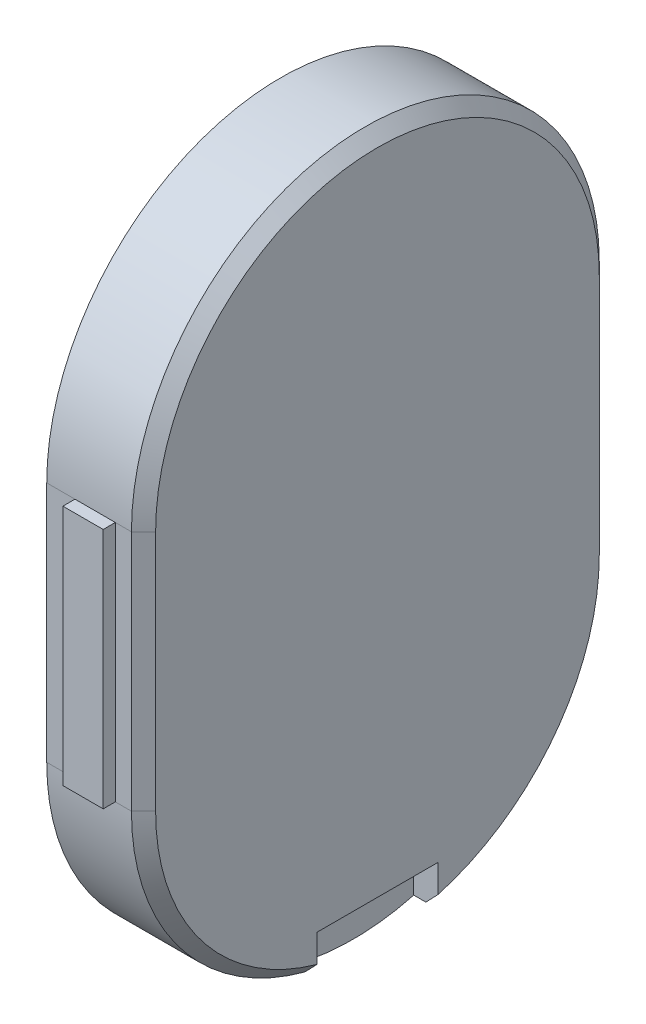
from build123d import *

# Parameters (mm, degrees)
BOSS_EXTRUDE1_START = 35.6
BOSS_EXTRUDE1_DEPTH = 2.4
CHAMFER1_SIZE       = 0.3
BOSS_EXTRUDE2_START = 82.2
SKETCH2_W           = 1
SKETCH2_H           = 6
BOSS_EXTRUDE2_DEPTH = 0.31
BOSS_EXTRUDE3_START = 94.09
SKETCH3_W           = 1
SKETCH3_H           = 6
BOSS_EXTRUDE3_DEPTH = 0.31
BOSS_EXTRUDE4_START = 86.8
SKETCH4_W           = 0.7
SKETCH4_H           = 1.3
BOSS_EXTRUDE4_DEPTH = 3


with BuildPart() as part:
    # Sketch1 → Boss-Extrude1 (new body)
    with BuildSketch(Plane(origin=(0, 0, 0), x_dir=(0, 0, -1), z_dir=(1, 0, 0)).offset(BOSS_EXTRUDE1_START)):
        with BuildLine():
            Line((-94.1, 53), (-94.1, 59))
            ThreePointArc((-94.1, 59), (-92.401219331, 63.101219331), (-88.3, 64.8))
            ThreePointArc((-88.3, 64.8), (-84.198780669, 63.101219331), (-82.5, 59))
            Line((-82.5, 59), (-82.5, 53))
            ThreePointArc((-82.5, 53), (-84.198780669, 48.898780669), (-88.3, 47.2))
            ThreePointArc((-88.3, 47.2), (-92.401219331, 48.898780669), (-94.1, 53))
        make_face()
    extrude(amount=BOSS_EXTRUDE1_DEPTH)

    # Chamfer1
    chamfer1_edges = [part.edges().sort_by_distance(p)[0] for p in [
        (38, 47.2, 88.3),
        (38, 56, 82.5),
        (38, 56, 94.1),
        (38, 64.8, 88.3),
    ]]
    chamfer(chamfer1_edges, length=CHAMFER1_SIZE)

    # Sketch2 → Boss-Extrude2 (add)
    with BuildSketch(Plane.XY.offset(BOSS_EXTRUDE2_START)):
        with Locations((36.8, 56)):
            Rectangle(SKETCH2_W, SKETCH2_H)
    extrude(amount=BOSS_EXTRUDE2_DEPTH)

    # Sketch3 → Boss-Extrude3 (add)
    with BuildSketch(Plane.XY.offset(BOSS_EXTRUDE3_START)):
        with Locations((36.8, 56)):
            Rectangle(SKETCH3_W, SKETCH3_H)
    extrude(amount=BOSS_EXTRUDE3_DEPTH)


with BuildPart() as body_2:
    # Sketch4 → Boss-Extrude4 (new body)
    with BuildSketch(Plane.XY.offset(BOSS_EXTRUDE4_START)):
        with Locations((37.75, 47.75)):
            Rectangle(SKETCH4_W, SKETCH4_H)
    extrude(amount=BOSS_EXTRUDE4_DEPTH)


with BuildPart() as part_1:
    add(part.part)

    # Combine1: cut body 2
    add(body_2.part, mode=Mode.SUBTRACT)


solid = part_1.part
